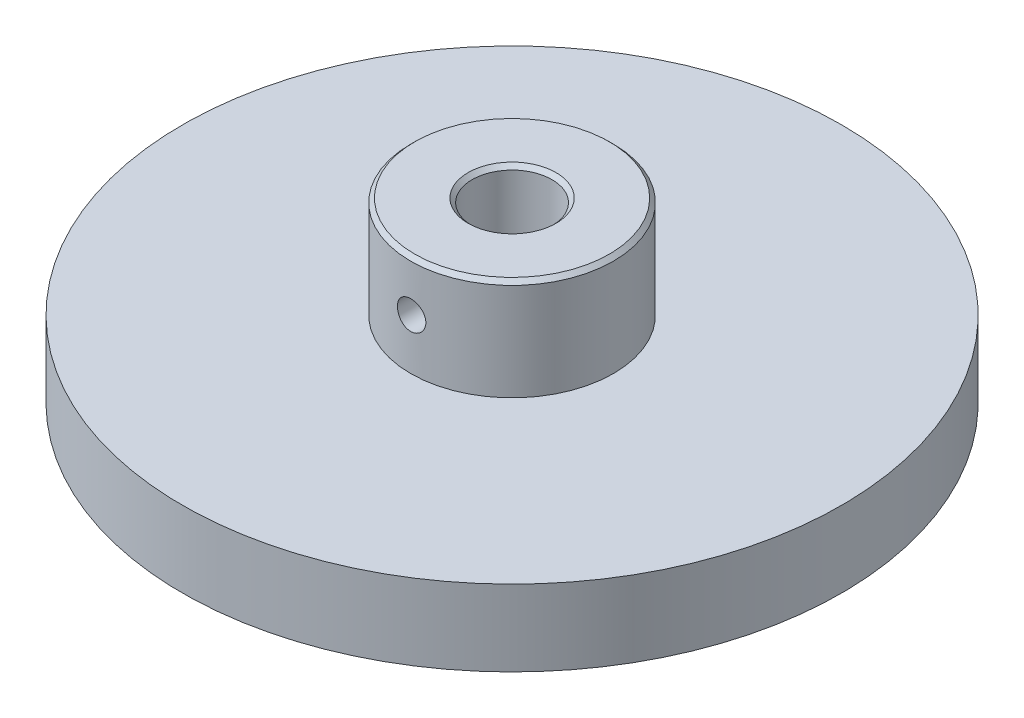
from build123d import *

# Parameters (mm, degrees)
SKETCH1_R           = 20.6375
BOSS_EXTRUDE1_DEPTH = 4.7625
SKETCH2_R           = 6.35
BOSS_EXTRUDE2_DEPTH = 6.35
SKETCH3_R           = 2.5
CUT_EXTRUDE1_DEPTH  = 32.229800972
CHAMFER1_SIZE       = 0.254
SKETCH5_W           = 0.889
SKETCH5_H           = 20.6375


with BuildPart() as part:
    # Sketch1 → Boss-Extrude1 (new body)
    with BuildSketch(Plane(origin=(0, 0, 0), x_dir=(1, 0, 0), z_dir=(0, 1, 0))):
        Circle(SKETCH1_R)
    extrude(amount=BOSS_EXTRUDE1_DEPTH)

    # Sketch2 → Boss-Extrude2 (add)
    with BuildSketch(Plane(origin=(0, 4.7625, 0), x_dir=(1, 0, 0), z_dir=(0, 1, 0))):
        Circle(SKETCH2_R)
    extrude(amount=BOSS_EXTRUDE2_DEPTH)

    # Sketch3 → Cut-Extrude1 (cut, through all)
    with BuildSketch(Plane.XZ):
        Circle(SKETCH3_R)
    extrude(amount=-CUT_EXTRUDE1_DEPTH, mode=Mode.SUBTRACT)

    # Chamfer1
    chamfer1_edges = [part.edges().sort_by_distance(p)[0] for p in [
        (-2.5, 0, 0),
        (-2.5, 11.1125, 0),
        (-6.35, 11.1125, 0),
    ]]
    chamfer(chamfer1_edges, length=CHAMFER1_SIZE)

    # Sketch5 → #2-56 Tapped Hole1 (revolve, cut)
    with BuildSketch(Plane(origin=(0, 7.9375, 0), x_dir=(0, 1, 0), z_dir=(1, 0, 0))):
        with Locations((0.4445, 10.31875)):
            Rectangle(SKETCH5_W, SKETCH5_H)
    revolve(axis=Axis((0, 7.9375, -6.35), (0, 0, 1)), mode=Mode.SUBTRACT)


solid = part.part
